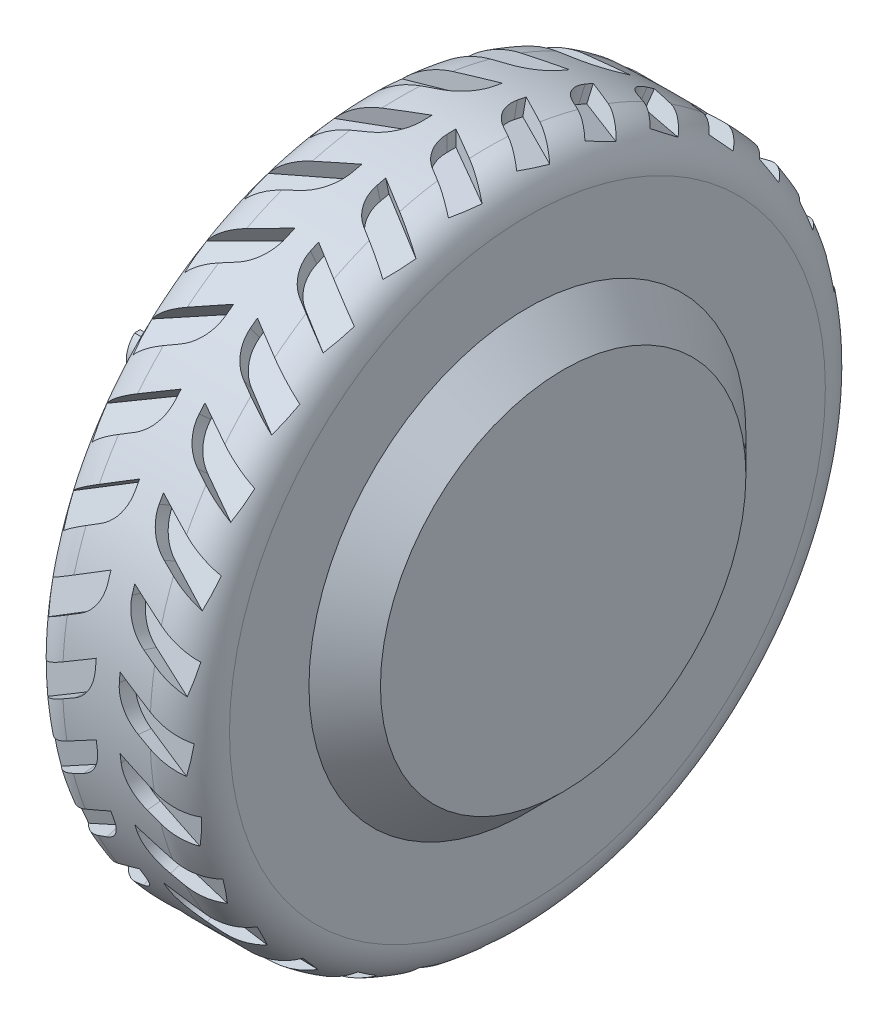
from build123d import *

# Parameters (mm, degrees)
SKETCH_1_R                 = 85
EXTRUDE_1_DEPTH            = 21
SKETCH_2_R                 = 55
EXTRUDE_2_DEPTH            = 9
CHAMFER_1_SIZE             = 9
FILLET_1_R                 = 10
CUT_EXTRUDE_2_DEPTH        = 4
PATTERN_CIRCULAR_1_COUNT   = 30
MIRROR_1_COPY_1_DEPTH      = 4
MIRROR_1_COPY_2_DEPTH      = 4
MIRROR_1_COPY_3_DEPTH      = 4
MIRROR_1_COPY_4_DEPTH      = 4
MIRROR_1_COPY_5_DEPTH      = 4
MIRROR_1_COPY_6_DEPTH      = 4
MIRROR_1_COPY_7_DEPTH      = 4
MIRROR_1_COPY_8_DEPTH      = 4
MIRROR_1_COPY_9_DEPTH      = 4
MIRROR_1_COPY_10_DEPTH     = 4
MIRROR_1_COPY_11_DEPTH     = 4
MIRROR_1_COPY_12_DEPTH     = 4
MIRROR_1_COPY_13_DEPTH     = 4
MIRROR_1_COPY_14_DEPTH     = 4
MIRROR_1_COPY_15_DEPTH     = 4
MIRROR_1_COPY_16_DEPTH     = 4
MIRROR_1_COPY_17_DEPTH     = 4
MIRROR_1_COPY_18_DEPTH     = 4
MIRROR_1_COPY_19_DEPTH     = 4
MIRROR_1_COPY_20_DEPTH     = 4
MIRROR_1_COPY_21_DEPTH     = 4
MIRROR_1_COPY_22_DEPTH     = 4
MIRROR_1_COPY_23_DEPTH     = 4
MIRROR_1_COPY_24_DEPTH     = 4
MIRROR_1_COPY_25_DEPTH     = 4
MIRROR_1_COPY_26_DEPTH     = 4
MIRROR_1_COPY_27_DEPTH     = 4
MIRROR_1_COPY_28_DEPTH     = 4
MIRROR_1_COPY_29_DEPTH     = 4
CHAMFER_1_OF_MIRROR_1_SIZE = 9
SKETCH_6_R                 = 7
EXTRUDE_3_DEPTH            = 43
CUT_EXTRUDE_START          = -38
CUT_EXTRUDE_3_DEPTH        = 38
CUT_EXTRUDE_4_DEPTH        = 5


with BuildPart() as part:
    # 草图1 → 凸台-拉伸1 (new, symmetric)
    with BuildSketch(Plane(origin=(0, 0, 0), x_dir=(0, 0, -1), z_dir=(1, 0, 0))):
        with Locations(Location((0, 0, 0), (0, 0, 180))):
            Circle(SKETCH_1_R)
    extrude(amount=EXTRUDE_1_DEPTH, both=True)

    # 草图2 → 凸台-拉伸2 (add)
    with BuildSketch(Plane(origin=(21, 0, 0), x_dir=(0, 0, -1), z_dir=(1, 0, 0))):
        Circle(SKETCH_2_R)
    extrude_2 = extrude(amount=EXTRUDE_2_DEPTH)

    # 倒角1
    chamfer_1_edges = [part.edges().sort_by_distance(p)[0] for p in [
        (30, 0, 55),
    ]]
    chamfer(chamfer_1_edges, length=CHAMFER_1_SIZE - 0.0001)  # a hair under: the kernel refuses the full size

    # 圆角1
    fillet_1_edges = [part.edges().sort_by_distance(p)[0] for p in [
        (-21, 0, -85),
        (21, 0, -85),
    ]]
    fillet(fillet_1_edges, radius=FILLET_1_R)

    # 草图4 → 切除-拉伸2 (cut)
    with BuildSketch(Plane(origin=(0, 85, 0), x_dir=(1, 0, 0), z_dir=(0, 1, 0))):
        with BuildLine():
            Line((3, 0), (3, -2.226497308))
            ThreePointArc((3, -2.226497308), (4.339745962, -7.226497308), (8, -10.886751346))
            Line((8, -10.886751346), (21, -18.392304845))
            Line((21, -18.392304845), (21, -10.392304845))
            Line((21, -10.392304845), (3, 0))
        make_face()
    cut_extrude_2 = extrude(amount=-CUT_EXTRUDE_2_DEPTH, mode=Mode.SUBTRACT)

    # 阵列(圆周)1: 切除-拉伸2 ×30 about axis
    pattern_circular_1_axis = Axis((0, 0, 0), (1, 0, 0))
    for i in range(1, PATTERN_CIRCULAR_1_COUNT):
        add(cut_extrude_2.rotate(pattern_circular_1_axis, i * 360 / PATTERN_CIRCULAR_1_COUNT), mode=Mode.SUBTRACT)

    # 镜向1: 凸台-拉伸2, 切除-拉伸2 across plane
    add(extrude_2.mirror(Plane(origin=(0, 0, 0), x_dir=(0, 0, 1), z_dir=(1, 0, 0))))
    add(cut_extrude_2.mirror(Plane(origin=(0, 0, 0), x_dir=(0, 0, 1), z_dir=(1, 0, 0))), mode=Mode.SUBTRACT)

    # 镜向1 copy 1 sketch → 镜向1 copy 1 (cut)
    with BuildSketch(Plane(origin=(0, 83.142546062, 17.67249372), x_dir=(-1, 0, 0), z_dir=(0, 0.9781476007338057, 0.20791169081775934))):
        with BuildLine():
            Line((3, 0), (3, 2.226497308))
            ThreePointArc((3, 2.226497308), (4.339745962, 7.226497308), (8, 10.886751346))
            Line((8, 10.886751346), (21, 18.392304845))
            Line((21, 18.392304845), (21, 10.392304845))
            Line((21, 10.392304845), (3, 0))
        make_face()
    extrude(amount=-MIRROR_1_COPY_1_DEPTH, mode=Mode.SUBTRACT)

    # 镜向1 copy 2 sketch → 镜向1 copy 2 (cut)
    with BuildSketch(Plane(origin=(0, 77.6513639, 34.572614661), x_dir=(-1, 0, 0), z_dir=(0, 0.9135454576426009, 0.4067366430758002))):
        with BuildLine():
            Line((3, 0), (3, 2.226497308))
            ThreePointArc((3, 2.226497308), (4.339745962, 7.226497308), (8, 10.886751346))
            Line((8, 10.886751346), (21, 18.392304845))
            Line((21, 18.392304845), (21, 10.392304845))
            Line((21, 10.392304845), (3, 0))
        make_face()
    extrude(amount=-MIRROR_1_COPY_2_DEPTH, mode=Mode.SUBTRACT)

    # 镜向1 copy 3 sketch → 镜向1 copy 3 (cut)
    with BuildSketch(Plane(origin=(0, 68.766444522, 49.961746445), x_dir=(-1, 0, 0), z_dir=(0, 0.8090169943749475, 0.5877852522924731))):
        with BuildLine():
            Line((3, 0), (3, 2.226497308))
            ThreePointArc((3, 2.226497308), (4.339745962, 7.226497308), (8, 10.886751346))
            Line((8, 10.886751346), (21, 18.392304845))
            Line((21, 18.392304845), (21, 10.392304845))
            Line((21, 10.392304845), (3, 0))
        make_face()
    extrude(amount=-MIRROR_1_COPY_3_DEPTH, mode=Mode.SUBTRACT)

    # 镜向1 copy 4 sketch → 镜向1 copy 4 (cut)
    with BuildSketch(Plane(origin=(0, 56.876101541, 63.167310166), x_dir=(-1, 0, 0), z_dir=(0, 0.6691306063588582, 0.7431448254773942))):
        with BuildLine():
            Line((3, 0), (3, 2.226497308))
            ThreePointArc((3, 2.226497308), (4.339745962, 7.226497308), (8, 10.886751346))
            Line((8, 10.886751346), (21, 18.392304845))
            Line((21, 18.392304845), (21, 10.392304845))
            Line((21, 10.392304845), (3, 0))
        make_face()
    extrude(amount=-MIRROR_1_COPY_4_DEPTH, mode=Mode.SUBTRACT)

    # 镜向1 copy 5 sketch → 镜向1 copy 5 (cut)
    with BuildSketch(Plane(origin=(0, 42.5, 73.612159322), x_dir=(-1, 0, 0), z_dir=(0, 0.5000000000000001, 0.8660254037844386))):
        with BuildLine():
            Line((3, 0), (3, 2.226497308))
            ThreePointArc((3, 2.226497308), (4.339745962, 7.226497308), (8, 10.886751346))
            Line((8, 10.886751346), (21, 18.392304845))
            Line((21, 18.392304845), (21, 10.392304845))
            Line((21, 10.392304845), (3, 0))
        make_face()
    extrude(amount=-MIRROR_1_COPY_5_DEPTH, mode=Mode.SUBTRACT)

    # 镜向1 copy 6 sketch → 镜向1 copy 6 (cut)
    with BuildSketch(Plane(origin=(0, 26.266444522, 80.839803885), x_dir=(-1, 0, 0), z_dir=(0, 0.30901699437494745, 0.9510565162951535))):
        with BuildLine():
            Line((3, 0), (3, 2.226497308))
            ThreePointArc((3, 2.226497308), (4.339745962, 7.226497308), (8, 10.886751346))
            Line((8, 10.886751346), (21, 18.392304845))
            Line((21, 18.392304845), (21, 10.392304845))
            Line((21, 10.392304845), (3, 0))
        make_face()
    extrude(amount=-MIRROR_1_COPY_6_DEPTH, mode=Mode.SUBTRACT)

    # 镜向1 copy 7 sketch → 镜向1 copy 7 (cut)
    with BuildSketch(Plane(origin=(0, 8.884919378, 84.534361106), x_dir=(-1, 0, 0), z_dir=(0, 0.10452846326765346, 0.9945218953682733))):
        with BuildLine():
            Line((3, 0), (3, 2.226497308))
            ThreePointArc((3, 2.226497308), (4.339745962, 7.226497308), (8, 10.886751346))
            Line((8, 10.886751346), (21, 18.392304845))
            Line((21, 18.392304845), (21, 10.392304845))
            Line((21, 10.392304845), (3, 0))
        make_face()
    extrude(amount=-MIRROR_1_COPY_7_DEPTH, mode=Mode.SUBTRACT)

    # 镜向1 copy 8 sketch → 镜向1 copy 8 (cut)
    with BuildSketch(Plane(origin=(0, -8.884919378, 84.534361106), x_dir=(-1, 0, 0), z_dir=(0, -0.10452846326765355, 0.9945218953682733))):
        with BuildLine():
            Line((3, 0), (3, 2.226497308))
            ThreePointArc((3, 2.226497308), (4.339745962, 7.226497308), (8, 10.886751346))
            Line((8, 10.886751346), (21, 18.392304845))
            Line((21, 18.392304845), (21, 10.392304845))
            Line((21, 10.392304845), (3, 0))
        make_face()
    extrude(amount=-MIRROR_1_COPY_8_DEPTH, mode=Mode.SUBTRACT)

    # 镜向1 copy 9 sketch → 镜向1 copy 9 (cut)
    with BuildSketch(Plane(origin=(0, -26.266444522, 80.839803885), x_dir=(-1, 0, 0), z_dir=(0, -0.30901699437494734, 0.9510565162951536))):
        with BuildLine():
            Line((3, 0), (3, 2.226497308))
            ThreePointArc((3, 2.226497308), (4.339745962, 7.226497308), (8, 10.886751346))
            Line((8, 10.886751346), (21, 18.392304845))
            Line((21, 18.392304845), (21, 10.392304845))
            Line((21, 10.392304845), (3, 0))
        make_face()
    extrude(amount=-MIRROR_1_COPY_9_DEPTH, mode=Mode.SUBTRACT)

    # 镜向1 copy 10 sketch → 镜向1 copy 10 (cut)
    with BuildSketch(Plane(origin=(0, -42.5, 73.612159322), x_dir=(-1, 0, 0), z_dir=(0, -0.4999999999999998, 0.8660254037844387))):
        with BuildLine():
            Line((3, 0), (3, 2.226497308))
            ThreePointArc((3, 2.226497308), (4.339745962, 7.226497308), (8, 10.886751346))
            Line((8, 10.886751346), (21, 18.392304845))
            Line((21, 18.392304845), (21, 10.392304845))
            Line((21, 10.392304845), (3, 0))
        make_face()
    extrude(amount=-MIRROR_1_COPY_10_DEPTH, mode=Mode.SUBTRACT)

    # 镜向1 copy 11 sketch → 镜向1 copy 11 (cut)
    with BuildSketch(Plane(origin=(0, -56.876101541, 63.167310166), x_dir=(-1, 0, 0), z_dir=(0, -0.6691306063588582, 0.7431448254773942))):
        with BuildLine():
            Line((3, 0), (3, 2.226497308))
            ThreePointArc((3, 2.226497308), (4.339745962, 7.226497308), (8, 10.886751346))
            Line((8, 10.886751346), (21, 18.392304845))
            Line((21, 18.392304845), (21, 10.392304845))
            Line((21, 10.392304845), (3, 0))
        make_face()
    extrude(amount=-MIRROR_1_COPY_11_DEPTH, mode=Mode.SUBTRACT)

    # 镜向1 copy 12 sketch → 镜向1 copy 12 (cut)
    with BuildSketch(Plane(origin=(0, -68.766444522, 49.961746445), x_dir=(-1, 0, 0), z_dir=(0, -0.8090169943749473, 0.5877852522924732))):
        with BuildLine():
            Line((3, 0), (3, 2.226497308))
            ThreePointArc((3, 2.226497308), (4.339745962, 7.226497308), (8, 10.886751346))
            Line((8, 10.886751346), (21, 18.392304845))
            Line((21, 18.392304845), (21, 10.392304845))
            Line((21, 10.392304845), (3, 0))
        make_face()
    extrude(amount=-MIRROR_1_COPY_12_DEPTH, mode=Mode.SUBTRACT)

    # 镜向1 copy 13 sketch → 镜向1 copy 13 (cut)
    with BuildSketch(Plane(origin=(0, -77.6513639, 34.572614661), x_dir=(-1, 0, 0), z_dir=(0, -0.9135454576426008, 0.40673664307580043))):
        with BuildLine():
            Line((3, 0), (3, 2.226497308))
            ThreePointArc((3, 2.226497308), (4.339745962, 7.226497308), (8, 10.886751346))
            Line((8, 10.886751346), (21, 18.392304845))
            Line((21, 18.392304845), (21, 10.392304845))
            Line((21, 10.392304845), (3, 0))
        make_face()
    extrude(amount=-MIRROR_1_COPY_13_DEPTH, mode=Mode.SUBTRACT)

    # 镜向1 copy 14 sketch → 镜向1 copy 14 (cut)
    with BuildSketch(Plane(origin=(0, -83.142546062, 17.67249372), x_dir=(-1, 0, 0), z_dir=(0, -0.9781476007338057, 0.20791169081775931))):
        with BuildLine():
            Line((3, 0), (3, 2.226497308))
            ThreePointArc((3, 2.226497308), (4.339745962, 7.226497308), (8, 10.886751346))
            Line((8, 10.886751346), (21, 18.392304845))
            Line((21, 18.392304845), (21, 10.392304845))
            Line((21, 10.392304845), (3, 0))
        make_face()
    extrude(amount=-MIRROR_1_COPY_14_DEPTH, mode=Mode.SUBTRACT)

    # 镜向1 copy 15 sketch → 镜向1 copy 15 (cut)
    with BuildSketch(Plane(origin=(0, -85, 0), x_dir=(-1, 0, 0), z_dir=(0, -1, 0))):
        with BuildLine():
            Line((3, 0), (3, 2.226497308))
            ThreePointArc((3, 2.226497308), (4.339745962, 7.226497308), (8, 10.886751346))
            Line((8, 10.886751346), (21, 18.392304845))
            Line((21, 18.392304845), (21, 10.392304845))
            Line((21, 10.392304845), (3, 0))
        make_face()
    extrude(amount=-MIRROR_1_COPY_15_DEPTH, mode=Mode.SUBTRACT)

    # 镜向1 copy 16 sketch → 镜向1 copy 16 (cut)
    with BuildSketch(Plane(origin=(0, -83.142546062, -17.67249372), x_dir=(-1, 0, 0), z_dir=(0, -0.9781476007338056, -0.2079116908177595))):
        with BuildLine():
            Line((3, 0), (3, 2.226497308))
            ThreePointArc((3, 2.226497308), (4.339745962, 7.226497308), (8, 10.886751346))
            Line((8, 10.886751346), (21, 18.392304845))
            Line((21, 18.392304845), (21, 10.392304845))
            Line((21, 10.392304845), (3, 0))
        make_face()
    extrude(amount=-MIRROR_1_COPY_16_DEPTH, mode=Mode.SUBTRACT)

    # 镜向1 copy 17 sketch → 镜向1 copy 17 (cut)
    with BuildSketch(Plane(origin=(0, -77.6513639, -34.572614661), x_dir=(-1, 0, 0), z_dir=(0, -0.9135454576426009, -0.4067366430758002))):
        with BuildLine():
            Line((3, 0), (3, 2.226497308))
            ThreePointArc((3, 2.226497308), (4.339745962, 7.226497308), (8, 10.886751346))
            Line((8, 10.886751346), (21, 18.392304845))
            Line((21, 18.392304845), (21, 10.392304845))
            Line((21, 10.392304845), (3, 0))
        make_face()
    extrude(amount=-MIRROR_1_COPY_17_DEPTH, mode=Mode.SUBTRACT)

    # 镜向1 copy 18 sketch → 镜向1 copy 18 (cut)
    with BuildSketch(Plane(origin=(0, -68.766444522, -49.961746445), x_dir=(-1, 0, 0), z_dir=(0, -0.8090169943749476, -0.587785252292473))):
        with BuildLine():
            Line((3, 0), (3, 2.226497308))
            ThreePointArc((3, 2.226497308), (4.339745962, 7.226497308), (8, 10.886751346))
            Line((8, 10.886751346), (21, 18.392304845))
            Line((21, 18.392304845), (21, 10.392304845))
            Line((21, 10.392304845), (3, 0))
        make_face()
    extrude(amount=-MIRROR_1_COPY_18_DEPTH, mode=Mode.SUBTRACT)

    # 镜向1 copy 19 sketch → 镜向1 copy 19 (cut)
    with BuildSketch(Plane(origin=(0, -56.876101541, -63.167310166), x_dir=(-1, 0, 0), z_dir=(0, -0.6691306063588581, -0.7431448254773944))):
        with BuildLine():
            Line((3, 0), (3, 2.226497308))
            ThreePointArc((3, 2.226497308), (4.339745962, 7.226497308), (8, 10.886751346))
            Line((8, 10.886751346), (21, 18.392304845))
            Line((21, 18.392304845), (21, 10.392304845))
            Line((21, 10.392304845), (3, 0))
        make_face()
    extrude(amount=-MIRROR_1_COPY_19_DEPTH, mode=Mode.SUBTRACT)

    # 镜向1 copy 20 sketch → 镜向1 copy 20 (cut)
    with BuildSketch(Plane(origin=(0, -42.5, -73.612159322), x_dir=(-1, 0, 0), z_dir=(0, -0.5000000000000004, -0.8660254037844384))):
        with BuildLine():
            Line((3, 0), (3, 2.226497308))
            ThreePointArc((3, 2.226497308), (4.339745962, 7.226497308), (8, 10.886751346))
            Line((8, 10.886751346), (21, 18.392304845))
            Line((21, 18.392304845), (21, 10.392304845))
            Line((21, 10.392304845), (3, 0))
        make_face()
    extrude(amount=-MIRROR_1_COPY_20_DEPTH, mode=Mode.SUBTRACT)

    # 镜向1 copy 21 sketch → 镜向1 copy 21 (cut)
    with BuildSketch(Plane(origin=(0, -26.266444522, -80.839803885), x_dir=(-1, 0, 0), z_dir=(0, -0.30901699437494756, -0.9510565162951535))):
        with BuildLine():
            Line((3, 0), (3, 2.226497308))
            ThreePointArc((3, 2.226497308), (4.339745962, 7.226497308), (8, 10.886751346))
            Line((8, 10.886751346), (21, 18.392304845))
            Line((21, 18.392304845), (21, 10.392304845))
            Line((21, 10.392304845), (3, 0))
        make_face()
    extrude(amount=-MIRROR_1_COPY_21_DEPTH, mode=Mode.SUBTRACT)

    # 镜向1 copy 22 sketch → 镜向1 copy 22 (cut)
    with BuildSketch(Plane(origin=(0, -8.884919378, -84.534361106), x_dir=(-1, 0, 0), z_dir=(0, -0.10452846326765336, -0.9945218953682734))):
        with BuildLine():
            Line((3, 0), (3, 2.226497308))
            ThreePointArc((3, 2.226497308), (4.339745962, 7.226497308), (8, 10.886751346))
            Line((8, 10.886751346), (21, 18.392304845))
            Line((21, 18.392304845), (21, 10.392304845))
            Line((21, 10.392304845), (3, 0))
        make_face()
    extrude(amount=-MIRROR_1_COPY_22_DEPTH, mode=Mode.SUBTRACT)

    # 镜向1 copy 23 sketch → 镜向1 copy 23 (cut)
    with BuildSketch(Plane(origin=(0, 8.884919378, -84.534361106), x_dir=(-1, 0, 0), z_dir=(0, 0.10452846326765299, -0.9945218953682734))):
        with BuildLine():
            Line((3, 0), (3, 2.226497308))
            ThreePointArc((3, 2.226497308), (4.339745962, 7.226497308), (8, 10.886751346))
            Line((8, 10.886751346), (21, 18.392304845))
            Line((21, 18.392304845), (21, 10.392304845))
            Line((21, 10.392304845), (3, 0))
        make_face()
    extrude(amount=-MIRROR_1_COPY_23_DEPTH, mode=Mode.SUBTRACT)

    # 镜向1 copy 24 sketch → 镜向1 copy 24 (cut)
    with BuildSketch(Plane(origin=(0, 26.266444522, -80.839803885), x_dir=(-1, 0, 0), z_dir=(0, 0.30901699437494723, -0.9510565162951536))):
        with BuildLine():
            Line((3, 0), (3, 2.226497308))
            ThreePointArc((3, 2.226497308), (4.339745962, 7.226497308), (8, 10.886751346))
            Line((8, 10.886751346), (21, 18.392304845))
            Line((21, 18.392304845), (21, 10.392304845))
            Line((21, 10.392304845), (3, 0))
        make_face()
    extrude(amount=-MIRROR_1_COPY_24_DEPTH, mode=Mode.SUBTRACT)

    # 镜向1 copy 25 sketch → 镜向1 copy 25 (cut)
    with BuildSketch(Plane(origin=(0, 42.5, -73.612159322), x_dir=(-1, 0, 0), z_dir=(0, 0.5000000000000001, -0.8660254037844386))):
        with BuildLine():
            Line((3, 0), (3, 2.226497308))
            ThreePointArc((3, 2.226497308), (4.339745962, 7.226497308), (8, 10.886751346))
            Line((8, 10.886751346), (21, 18.392304845))
            Line((21, 18.392304845), (21, 10.392304845))
            Line((21, 10.392304845), (3, 0))
        make_face()
    extrude(amount=-MIRROR_1_COPY_25_DEPTH, mode=Mode.SUBTRACT)

    # 镜向1 copy 26 sketch → 镜向1 copy 26 (cut)
    with BuildSketch(Plane(origin=(0, 56.876101541, -63.167310166), x_dir=(-1, 0, 0), z_dir=(0, 0.6691306063588578, -0.7431448254773946))):
        with BuildLine():
            Line((3, 0), (3, 2.226497308))
            ThreePointArc((3, 2.226497308), (4.339745962, 7.226497308), (8, 10.886751346))
            Line((8, 10.886751346), (21, 18.392304845))
            Line((21, 18.392304845), (21, 10.392304845))
            Line((21, 10.392304845), (3, 0))
        make_face()
    extrude(amount=-MIRROR_1_COPY_26_DEPTH, mode=Mode.SUBTRACT)

    # 镜向1 copy 27 sketch → 镜向1 copy 27 (cut)
    with BuildSketch(Plane(origin=(0, 68.766444522, -49.961746445), x_dir=(-1, 0, 0), z_dir=(0, 0.8090169943749473, -0.5877852522924734))):
        with BuildLine():
            Line((3, 0), (3, 2.226497308))
            ThreePointArc((3, 2.226497308), (4.339745962, 7.226497308), (8, 10.886751346))
            Line((8, 10.886751346), (21, 18.392304845))
            Line((21, 18.392304845), (21, 10.392304845))
            Line((21, 10.392304845), (3, 0))
        make_face()
    extrude(amount=-MIRROR_1_COPY_27_DEPTH, mode=Mode.SUBTRACT)

    # 镜向1 copy 28 sketch → 镜向1 copy 28 (cut)
    with BuildSketch(Plane(origin=(0, 77.6513639, -34.572614661), x_dir=(-1, 0, 0), z_dir=(0, 0.913545457642601, -0.40673664307580015))):
        with BuildLine():
            Line((3, 0), (3, 2.226497308))
            ThreePointArc((3, 2.226497308), (4.339745962, 7.226497308), (8, 10.886751346))
            Line((8, 10.886751346), (21, 18.392304845))
            Line((21, 18.392304845), (21, 10.392304845))
            Line((21, 10.392304845), (3, 0))
        make_face()
    extrude(amount=-MIRROR_1_COPY_28_DEPTH, mode=Mode.SUBTRACT)

    # 镜向1 copy 29 sketch → 镜向1 copy 29 (cut)
    with BuildSketch(Plane(origin=(0, 83.142546062, -17.67249372), x_dir=(-1, 0, 0), z_dir=(0, 0.9781476007338056, -0.20791169081775987))):
        with BuildLine():
            Line((3, 0), (3, 2.226497308))
            ThreePointArc((3, 2.226497308), (4.339745962, 7.226497308), (8, 10.886751346))
            Line((8, 10.886751346), (21, 18.392304845))
            Line((21, 18.392304845), (21, 10.392304845))
            Line((21, 10.392304845), (3, 0))
        make_face()
    extrude(amount=-MIRROR_1_COPY_29_DEPTH, mode=Mode.SUBTRACT)

    # 倒角1 of 镜向1
    chamfer_1_of_mirror_1_edges = [part.edges().sort_by_distance(p)[0] for p in [
        (-30, 0, 55),
    ]]
    chamfer(chamfer_1_of_mirror_1_edges, length=CHAMFER_1_OF_MIRROR_1_SIZE - 0.0001)  # a hair under: the kernel refuses the full size

    # 草图6 → 凸台-拉伸3 (add)
    with BuildSketch(Plane.ZY.offset(30)):
        Circle(SKETCH_6_R)
    extrude(amount=EXTRUDE_3_DEPTH)

    # 草图7 → 切除-拉伸3 (cut)
    with BuildSketch(Plane.ZY.offset(73).offset(CUT_EXTRUDE_START)):
        with BuildLine():
            Line((-4.898979486, 5), (4.898979486, 5))
            ThreePointArc((4.898979486, 5), (0, 7), (-4.898979486, 5))
        make_face()
        with BuildLine():
            Line((-4.898979486, -5), (4.898979486, -5))
            ThreePointArc((4.898979486, -5), (0, -7), (-4.898979486, -5))
        make_face()
    extrude(amount=CUT_EXTRUDE_3_DEPTH, mode=Mode.SUBTRACT)

    # 草图8 → 切除-拉伸4 (cut)
    with BuildSketch(Plane(origin=(0, 5, 0), x_dir=(1, 0, 0), z_dir=(0, 1, 0))):
        with BuildLine():
            Line((-73, 3.5), (-70, 3.5))
            ThreePointArc((-70, 3.5), (-66.5, 0), (-70, -3.5))
            Line((-70, -3.5), (-73, -3.5))
            ThreePointArc((-73, -3.5), (-76.5, 0), (-73, 3.5))
        make_face()
    extrude(amount=-CUT_EXTRUDE_4_DEPTH, mode=Mode.SUBTRACT)


solid = part.part
